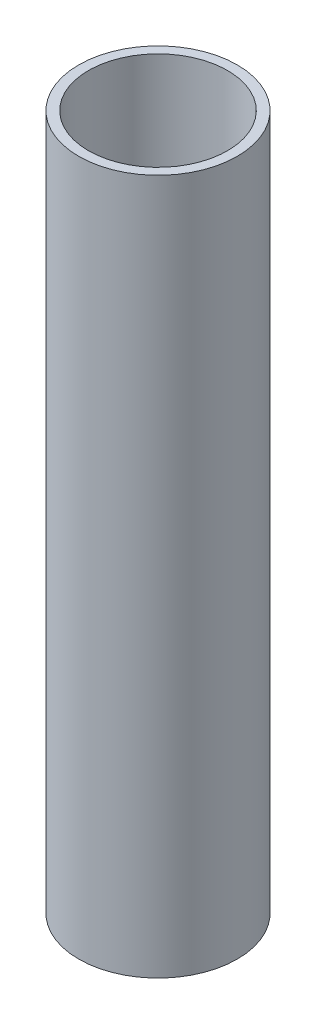
from build123d import *

# Parameters (mm, degrees)
SKETCH1_R           = 14.478
SKETCH1_R_2         = 12.7
BOSS_EXTRUDE1_DEPTH = 127


with BuildPart() as part:
    # Sketch1 → Boss-Extrude1 (new body)
    with BuildSketch(Plane(origin=(0, 0, 0), x_dir=(1, 0, 0), z_dir=(0, 1, 0))):
        Circle(SKETCH1_R)
        Circle(SKETCH1_R_2, mode=Mode.SUBTRACT)
    extrude(amount=BOSS_EXTRUDE1_DEPTH)


solid = part.part
